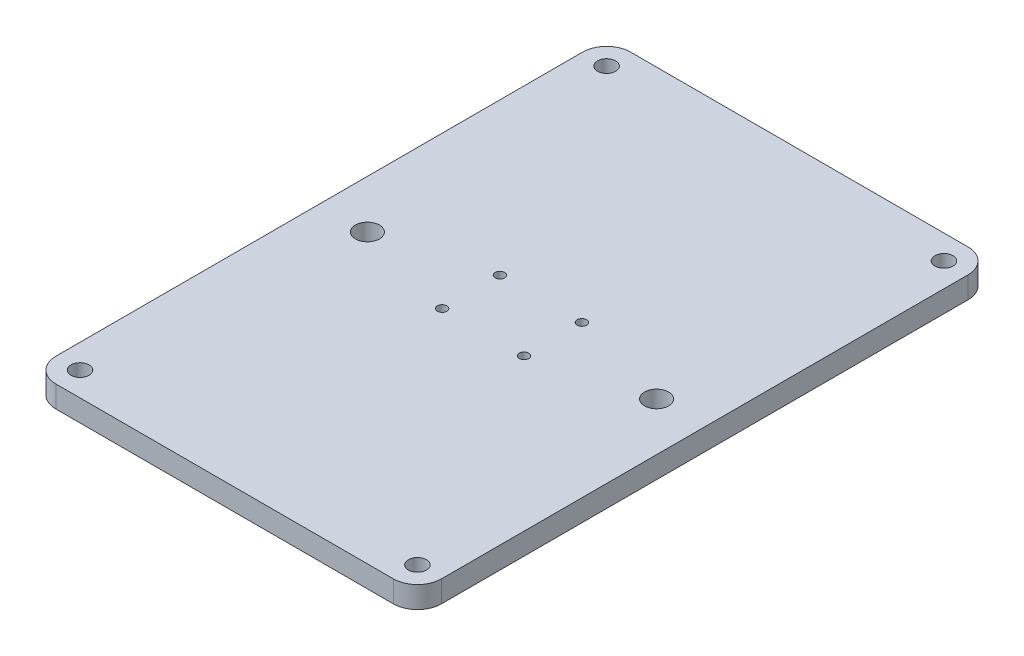
from build123d import *

# Parameters (mm, degrees)
SKETCH1_R           = 1.25
SKETCH1_R_2         = 3.175
SKETCH1_R_3         = 2.38125
BOSS_EXTRUDE1_DEPTH = 5.715


with BuildPart() as part:
    # Sketch1 → Boss-Extrude1 (new body)
    with BuildSketch(Plane(origin=(0, 12.499999892, 0), x_dir=(1, 0, 0), z_dir=(0, 1, 0))):
        with BuildLine():
            Line((-44.45, -75.719872981), (44.45, -75.719872981))
            ThreePointArc((44.45, -75.719872981), (48.940128061, -73.860001042), (50.8, -69.369872981))
            Line((50.8, -69.369872981), (50.8, 69.369872981))
            ThreePointArc((50.8, 69.369872981), (48.940128061, 73.860001042), (44.45, 75.719872981))
            Line((44.45, 75.719872981), (-44.45, 75.719872981))
            ThreePointArc((-44.45, 75.719872981), (-48.940128061, 73.860001042), (-50.8, 69.369872981))
            Line((-50.8, 69.369872981), (-50.8, -69.369872981))
            ThreePointArc((-50.8, -69.369872981), (-48.940128061, -73.860001042), (-44.45, -75.719872981))
        make_face()
        with Locations((-10.795, 7.62)):
            Circle(SKETCH1_R, mode=Mode.SUBTRACT)
        with Locations((-10.795, -7.62)):
            Circle(SKETCH1_R, mode=Mode.SUBTRACT)
        with Locations((10.795, -7.62)):
            Circle(SKETCH1_R, mode=Mode.SUBTRACT)
        with Locations((10.795, 7.62)):
            Circle(SKETCH1_R, mode=Mode.SUBTRACT)
        with Locations((38.1, 0)):
            Circle(SKETCH1_R_2, mode=Mode.SUBTRACT)
        with Locations((-38.1, 0)):
            Circle(SKETCH1_R_2, mode=Mode.SUBTRACT)
        with Locations((44.45, 69.369872981)):
            Circle(SKETCH1_R_3, mode=Mode.SUBTRACT)
        with Locations((-44.45, 69.369872981)):
            Circle(SKETCH1_R_3, mode=Mode.SUBTRACT)
        with Locations((-44.45, -69.369872981)):
            Circle(SKETCH1_R_3, mode=Mode.SUBTRACT)
        with Locations((44.45, -69.369872981)):
            Circle(SKETCH1_R_3, mode=Mode.SUBTRACT)
    extrude(amount=BOSS_EXTRUDE1_DEPTH)


solid = part.part
